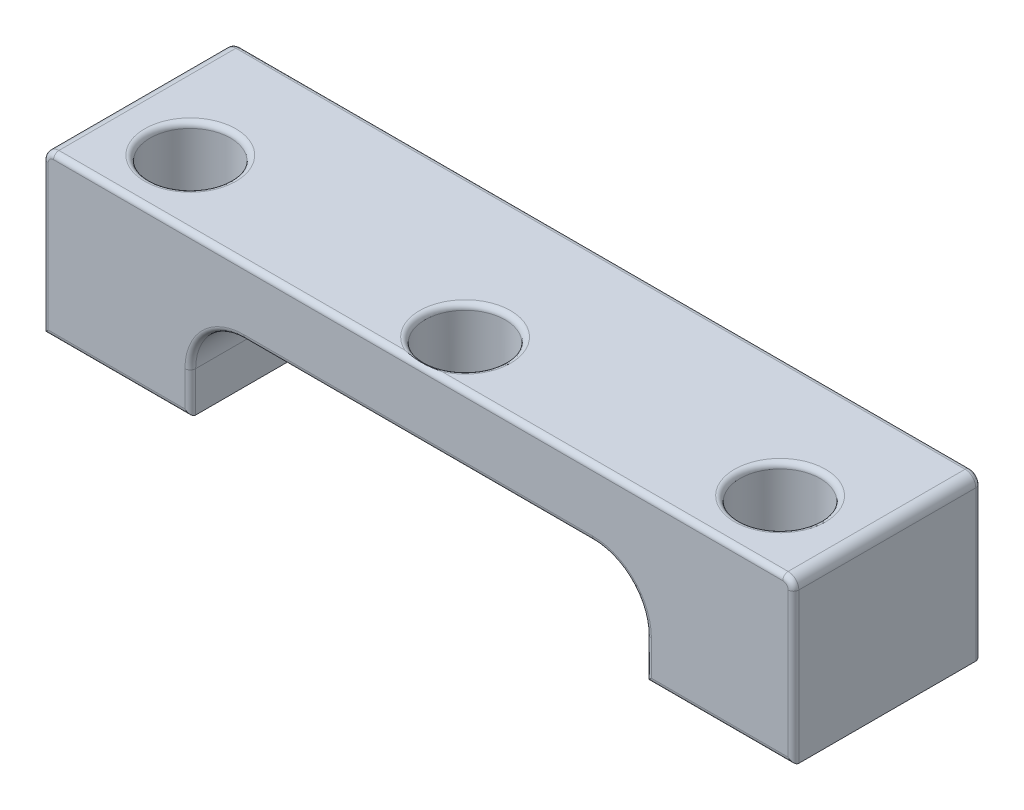
from build123d import *

# Parameters (mm, degrees)
BOSS_EXTRUDE1_DEPTH = 3.5
SKETCH2_R           = 1.5
CUT_EXTRUDE1_DEPTH  = 16.628499608
FILLET1_R           = 2
FILLET2_R           = 0.4
FILLET3_R           = 0.2


with BuildPart() as part:
    # Sketch1 → Boss-Extrude1 (new, symmetric)
    with BuildSketch(Plane.XY):
        Polygon((-14, 0), (-14, 6), (14, 6), (14, 0), (8.5, 0), (8.5, 3.5), (-8.5, 3.5), (-8.5, 0), align=None)
    extrude(amount=BOSS_EXTRUDE1_DEPTH, both=True)

    # Sketch2 → Cut-Extrude1 (cut, through all)
    with BuildSketch(Plane(origin=(0, 6, 0), x_dir=(1, 0, 0), z_dir=(0, 1, 0))):
        with Locations(Location((11, -1, 0), (0, 0, 270))):
            Circle(SKETCH2_R)
        with Locations(Location((-11, -1, 0), (0, 0, 90))):
            Circle(SKETCH2_R)
        with Locations(Location((0, -1.75, 0), (0, 0, 270))):
            Circle(SKETCH2_R)
    extrude(amount=-CUT_EXTRUDE1_DEPTH, mode=Mode.SUBTRACT)

    # Fillet1
    fillet1_edges = [part.edges().sort_by_distance(p)[0] for p in [
        (8.5, 3.5, 0),
        (-8.5, 3.5, 0),
    ]]
    fillet(fillet1_edges, radius=FILLET1_R)

    # Fillet2
    fillet2_edges = [part.edges().sort_by_distance(p)[0] for p in [
        (-14, 6, 0),
        (14, 6, 0),
    ]]
    fillet(fillet2_edges, radius=FILLET2_R)

    # Fillet3
    # the kernel refuses this fillet: 0.2 mm, written as the material it takes off along each edge
    with BuildSketch(Plane(origin=(-8.5, 1.5, -3.5), x_dir=(-1, 0, 0), z_dir=(0, -1, 0)), Plane(origin=(8.5, -0.5, -3.5), x_dir=(1, 0, 0), z_dir=(0, 1, 0)), Plane(origin=(8.5, -0.5, 3.5), x_dir=(0, 0, -1), z_dir=(0, 1, 0)), Plane(origin=(-8.5, 1.5, 3.5), x_dir=(0, 0, -1), z_dir=(0, -1, 0))) as fillet3_piece_1:
        with BuildLine():
            CenterArc((FILLET3_R, -FILLET3_R), FILLET3_R, 90, 90)
            Line((0, -FILLET3_R), (0, 0))
            Line((0, 0), (FILLET3_R, 0))
        make_face()
    extrude(amount=2, mode=Mode.SUBTRACT)
    with BuildSketch(Plane(origin=(-8, 0, -3.5), x_dir=(0, 1, 0), z_dir=(-1, 0, 0)), Plane(origin=(14.5, 0, 3.5), x_dir=(0, 0, -1), z_dir=(-1, 0, 0)), Plane(origin=(-8, 0, 3.5), x_dir=(0, 0, -1), z_dir=(-1, 0, 0)), Plane(origin=(14.5, 0, -3.5), x_dir=(0, 1, 0), z_dir=(-1, 0, 0))) as fillet3_piece_2:
        with BuildLine():
            CenterArc((FILLET3_R, -FILLET3_R), FILLET3_R, 90, 90)
            Line((0, -FILLET3_R), (0, 0))
            Line((0, 0), (FILLET3_R, 0))
        make_face()
    extrude(amount=6.5, mode=Mode.SUBTRACT)
    with BuildSketch(Plane(origin=(14, 5.6, 3.5), x_dir=(0, 0, -1), z_dir=(0, -1, 0)), Plane(origin=(-14, -0.5, -3.5), x_dir=(1, 0, 0), z_dir=(0, 1, 0)), Plane(origin=(-14, -0.5, 3.5), x_dir=(0, 0, -1), z_dir=(0, 1, 0)), Plane(origin=(14, 5.6, -3.5), x_dir=(-1, 0, 0), z_dir=(0, -1, 0))) as fillet3_piece_3:
        with BuildLine():
            CenterArc((FILLET3_R, -FILLET3_R), FILLET3_R, 90, 90)
            Line((0, -FILLET3_R), (0, 0))
            Line((0, 0), (FILLET3_R, 0))
        make_face()
    extrude(amount=6.1, mode=Mode.SUBTRACT)
    with BuildSketch(Plane(origin=(11, 6, 1), x_dir=(0, 0, 1), z_dir=(-1, 0, 0))) as fillet3_piece_4:
        with BuildLine():
            CenterArc((1.5 + FILLET3_R, -FILLET3_R), FILLET3_R, 90, 90)
            Line((1.5, -FILLET3_R), (1.5, 0))
            Line((1.5, 0), (1.5 + FILLET3_R, 0))
        make_face()
    revolve(axis=Axis((11, 6, 1), (0, 1, 0)), mode=Mode.SUBTRACT)
    with BuildSketch(Plane(origin=(-11, 6, 1), x_dir=(0, 0, -1), z_dir=(1, 0, 0))) as fillet3_piece_5:
        with BuildLine():
            CenterArc((1.5 + FILLET3_R, -FILLET3_R), FILLET3_R, 90, 90)
            Line((1.5, -FILLET3_R), (1.5, 0))
            Line((1.5, 0), (1.5 + FILLET3_R, 0))
        make_face()
    revolve(axis=Axis((-11, 6, 1), (0, 1, 0)), mode=Mode.SUBTRACT)
    with BuildSketch(Plane(origin=(0, 6, 1.75), x_dir=(0, 0, 1), z_dir=(-1, 0, 0))) as fillet3_piece_6:
        with BuildLine():
            CenterArc((1.5 + FILLET3_R, -FILLET3_R), FILLET3_R, 90, 90)
            Line((1.5, -FILLET3_R), (1.5, 0))
            Line((1.5, 0), (1.5 + FILLET3_R, 0))
        make_face()
    revolve(axis=Axis((0, 6, 1.75), (0, 1, 0)), mode=Mode.SUBTRACT)
    with BuildSketch(Plane(origin=(6.5, 3.5, -3.5), x_dir=(0, 1, 0), z_dir=(-1, 0, 0)), Plane(origin=(6.5, 3.5, 3.5), x_dir=(0, 0, -1), z_dir=(-1, 0, 0))) as fillet3_piece_7:
        with BuildLine():
            CenterArc((FILLET3_R, -FILLET3_R), FILLET3_R, 90, 90)
            Line((0, -FILLET3_R), (0, 0))
            Line((0, 0), (FILLET3_R, 0))
        make_face()
    extrude(amount=13, mode=Mode.SUBTRACT)
    with BuildSketch(Plane(origin=(6.5, 1.5, -3.5), x_dir=(1, 0, 0), z_dir=(0, -1, 0))) as fillet3_piece_8:
        with BuildLine():
            CenterArc((2 + FILLET3_R, FILLET3_R), FILLET3_R, 180, 90)
            Line((2, FILLET3_R), (2, 0))
            Line((2, 0), (2 + FILLET3_R, 0))
        make_face()
    revolve(axis=Axis((6.5, 1.5, -3.5), (0, 0, 1)), revolution_arc=90, mode=Mode.SUBTRACT)
    with BuildSketch(Plane(origin=(6.5, 1.5, 3.5), x_dir=(1, 0, 0), z_dir=(0, -1, 0))) as fillet3_piece_9:
        with BuildLine():
            CenterArc((2 + FILLET3_R, -FILLET3_R), FILLET3_R, 90, 90)
            Line((2 + FILLET3_R, 0), (2, 0))
            Line((2, 0), (2, -FILLET3_R))
        make_face()
    revolve(axis=Axis((6.5, 1.5, 3.5), (0, 0, 1)), revolution_arc=90, mode=Mode.SUBTRACT)
    with BuildSketch(Plane(origin=(-6.5, 1.5, -3.5), x_dir=(-1, 0, 0), z_dir=(0, -1, 0))) as fillet3_piece_10:
        with BuildLine():
            CenterArc((2 + FILLET3_R, -FILLET3_R), FILLET3_R, 90, 90)
            Line((2, -FILLET3_R), (2, 0))
            Line((2, 0), (2 + FILLET3_R, 0))
        make_face()
    revolve(axis=Axis((-6.5, 1.5, -3.5), (0, 0, -1)), revolution_arc=90, mode=Mode.SUBTRACT)
    with BuildSketch(Plane(origin=(-6.5, 1.5, 3.5), x_dir=(-1, 0, 0), z_dir=(0, -1, 0))) as fillet3_piece_11:
        with BuildLine():
            CenterArc((2 + FILLET3_R, FILLET3_R), FILLET3_R, 180, 90)
            Line((2 + FILLET3_R, 0), (2, 0))
            Line((2, 0), (2, FILLET3_R))
        make_face()
    revolve(axis=Axis((-6.5, 1.5, 3.5), (0, 0, -1)), revolution_arc=90, mode=Mode.SUBTRACT)
    with BuildSketch(Plane(origin=(-13.6, 6, -3.5), x_dir=(0, -1, 0), z_dir=(1, 0, 0)), Plane(origin=(-13.6, 6, 3.5), x_dir=(0, 0, -1), z_dir=(1, 0, 0))) as fillet3_piece_12:
        with BuildLine():
            CenterArc((FILLET3_R, -FILLET3_R), FILLET3_R, 90, 90)
            Line((0, -FILLET3_R), (0, 0))
            Line((0, 0), (FILLET3_R, 0))
        make_face()
    extrude(amount=27.2, mode=Mode.SUBTRACT)
    with BuildSketch(Plane(origin=(-13.6, 5.6, -3.5), x_dir=(0, 1, 0), z_dir=(1, 0, 0))) as fillet3_piece_13:
        with BuildLine():
            CenterArc((0.4 - FILLET3_R, FILLET3_R), FILLET3_R, 270, 90)
            Line((0.4, FILLET3_R), (0.4, 0))
            Line((0.4, 0), (0.4 - FILLET3_R, 0))
        make_face()
    revolve(axis=Axis((-13.6, 5.6, -3.5), (0, 0, 1)), revolution_arc=90, mode=Mode.SUBTRACT)
    with BuildSketch(Plane(origin=(13.6, 5.6, -3.5), x_dir=(1, 0, 0), z_dir=(0, -1, 0))) as fillet3_piece_14:
        with BuildLine():
            CenterArc((0.4 - FILLET3_R, FILLET3_R), FILLET3_R, 270, 90)
            Line((0.4, FILLET3_R), (0.4, 0))
            Line((0.4, 0), (0.4 - FILLET3_R, 0))
        make_face()
    revolve(axis=Axis((13.6, 5.6, -3.5), (0, 0, 1)), revolution_arc=90, mode=Mode.SUBTRACT)
    with BuildSketch(Plane(origin=(-13.6, 5.6, 3.5), x_dir=(0, 1, 0), z_dir=(1, 0, 0))) as fillet3_piece_15:
        with BuildLine():
            CenterArc((0.4 - FILLET3_R, -FILLET3_R), FILLET3_R, 0, 90)
            Line((0.4 - FILLET3_R, 0), (0.4, 0))
            Line((0.4, 0), (0.4, -FILLET3_R))
        make_face()
    revolve(axis=Axis((-13.6, 5.6, 3.5), (0, 0, 1)), revolution_arc=90, mode=Mode.SUBTRACT)
    with BuildSketch(Plane(origin=(13.6, 5.6, 3.5), x_dir=(1, 0, 0), z_dir=(0, -1, 0))) as fillet3_piece_16:
        with BuildLine():
            CenterArc((0.4 - FILLET3_R, -FILLET3_R), FILLET3_R, 0, 90)
            Line((0.4 - FILLET3_R, 0), (0.4, 0))
            Line((0.4, 0), (0.4, -FILLET3_R))
        make_face()
    revolve(axis=Axis((13.6, 5.6, 3.5), (0, 0, 1)), revolution_arc=90, mode=Mode.SUBTRACT)


solid = part.part
